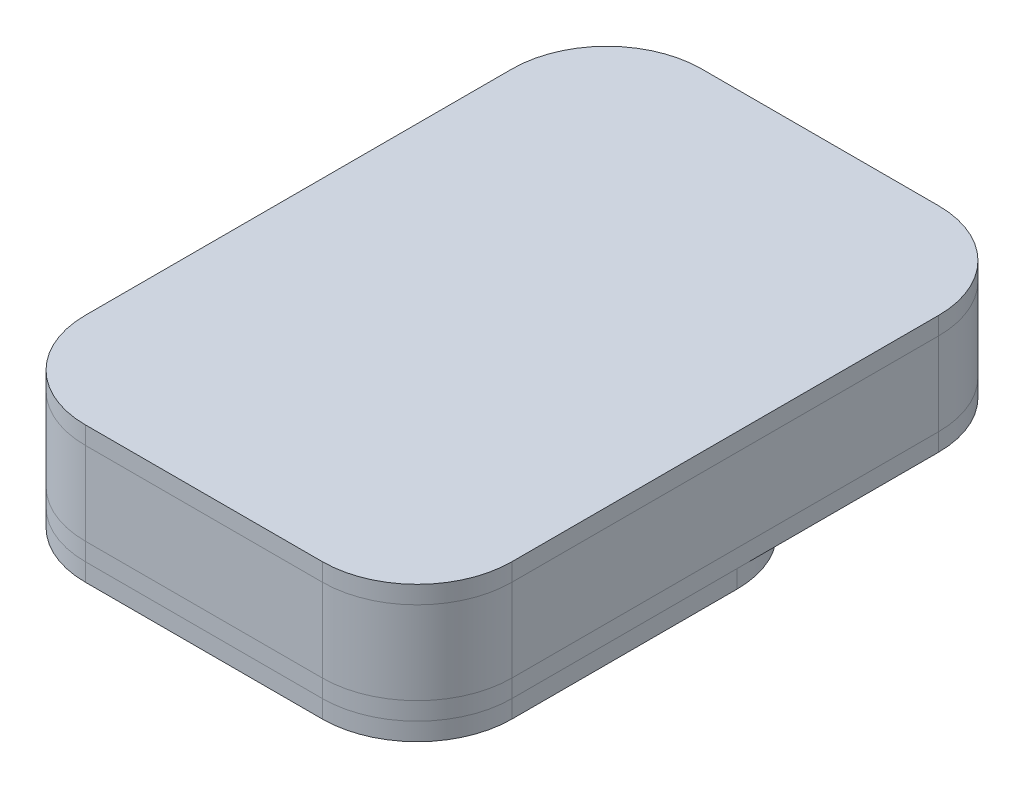
from build123d import *

# Parameters (mm, degrees)
SKETCH1_W           = 160
SKETCH1_H           = 240
BOSS_EXTRUDE1_DEPTH = 35
FILLET1_R           = 30
SHELL2_T            = 10
BOSS_EXTRUDE3_DEPTH = 7.5
BOSS_EXTRUDE4_DEPTH = 7.5
SKETCH6_W           = 180
SKETCH6_H           = 175
BOSS_EXTRUDE5_DEPTH = 7.5
FILLET2_R           = 40
SKETCH9_W           = 40
SKETCH9_H           = 60
CUT_EXTRUDE1_DEPTH  = 15
SKETCH10_W          = 40
SKETCH10_H          = 60
BOSS_EXTRUDE6_DEPTH = 7.5
SKETCH11_W          = 14.3
SKETCH11_H          = 26.3
CUT_EXTRUDE2_DEPTH  = 7.5
SKETCH12_R          = 10
CUT_EXTRUDE4_DEPTH  = 7.5


# Read off the part's stored shape, not the designer's step: Split2
with BuildPart() as part:
    # Sketch1 → Boss-Extrude1 (new body)
    with BuildSketch(Plane(origin=(0, 0, 0), x_dir=(1, 0, 0), z_dir=(0, 1, 0))):
        Rectangle(SKETCH1_W, SKETCH1_H)
    extrude(amount=BOSS_EXTRUDE1_DEPTH)

    # Fillet1
    fillet1_edges = [part.edges().sort_by_distance(p)[0] for p in [
        (-80, 17.5, 120),
        (-80, 17.5, -120),
        (80, 17.5, -120),
        (80, 17.5, 120),
    ]]
    fillet(fillet1_edges, radius=FILLET1_R)

    # Shell2
    shell2_openings = [part.faces().sort_by_distance(p)[0] for p in [
        (0, 0, 0),
        (0, 35, 0),
    ]]
    offset(amount=SHELL2_T, openings=shell2_openings, kind=Kind.INTERSECTION)


with BuildPart() as body_2:
    # Sketch2 → Boss-Extrude3 (new body)
    with BuildSketch(Plane.XZ):
        with BuildLine():
            Line((90, -90), (90, 90))
            ThreePointArc((90, 90), (78.284271247, 118.284271247), (50, 130))
            Line((50, 130), (-50, 130))
            ThreePointArc((-50, 130), (-78.284271247, 118.284271247), (-90, 90))
            Line((-90, 90), (-90, -90))
            ThreePointArc((-90, -90), (-78.284271247, -118.284271247), (-50, -130))
            Line((-50, -130), (50, -130))
            ThreePointArc((50, -130), (78.284271247, -118.284271247), (90, -90))
        make_face()
    extrude(amount=BOSS_EXTRUDE3_DEPTH)


with BuildPart() as body_3:
    # Sketch3 → Boss-Extrude4 (new body)
    with BuildSketch(Plane(origin=(0, 35, 0), x_dir=(1, 0, 0), z_dir=(0, 1, 0))):
        with BuildLine():
            Line((-50, -130), (50, -130))
            ThreePointArc((50, -130), (78.284271247, -118.284271247), (90, -90))
            Line((90, -90), (90, 90))
            ThreePointArc((90, 90), (78.284271247, 118.284271247), (50, 130))
            Line((50, 130), (-50, 130))
            ThreePointArc((-50, 130), (-78.284271247, 118.284271247), (-90, 90))
            Line((-90, 90), (-90, -90))
            ThreePointArc((-90, -90), (-78.284271247, -118.284271247), (-50, -130))
        make_face()
    extrude(amount=BOSS_EXTRUDE4_DEPTH)


with BuildPart() as body_4:
    # Sketch6 → Boss-Extrude5 (new body)
    with BuildSketch(Plane.XZ.offset(7.5)):
        with Locations((0, 42.5)):
            Rectangle(SKETCH6_W, SKETCH6_H)
    extrude(amount=BOSS_EXTRUDE5_DEPTH)

    # Fillet2
    fillet2_edges = [body_4.edges().sort_by_distance(p)[0] for p in [
        (-90, -11.25, 130),
        (90, -11.25, 130),
        (90, -11.25, -45),
        (-90, -11.25, -45),
    ]]
    fillet(fillet2_edges, radius=FILLET2_R)


with BuildPart() as cut_extrude1_tool:
    # Sketch9 → Cut-Extrude1 (new body)
    with BuildSketch(Plane.XZ.offset(15)):
        with Locations((0, 42.5)):
            Rectangle(SKETCH9_W, SKETCH9_H)
    extrude(amount=-CUT_EXTRUDE1_DEPTH)


with BuildPart() as body_2_1:
    add(body_2.part)

    # Cut-Extrude1: cut by cut_extrude1_tool
    add(cut_extrude1_tool.part, mode=Mode.SUBTRACT)



with BuildPart() as body_4_1:
    add(body_4.part)

    # Cut-Extrude1: cut by cut_extrude1_tool
    add(cut_extrude1_tool.part, mode=Mode.SUBTRACT)


with BuildPart() as body_2_2:
    add(body_2_1.part)

    add(body_4_1.part)  # Boss-Extrude6 merges body 4
    # Sketch10 → Boss-Extrude6 (add)
    with BuildSketch(Plane(origin=(0, -7.5, 0), x_dir=(1, 0, 0), z_dir=(0, 1, 0))):
        with Locations((0, -42.5)):
            Rectangle(SKETCH10_W, SKETCH10_H)
    extrude(amount=-BOSS_EXTRUDE6_DEPTH)

    # Sketch11 → Cut-Extrude2 (cut)
    with BuildSketch(Plane.XZ.offset(7.5)):
        with Locations((-25, -90)):
            Rectangle(SKETCH11_W, SKETCH11_H)
    extrude(amount=-CUT_EXTRUDE2_DEPTH, mode=Mode.SUBTRACT)

    # Sketch12 → Cut-Extrude4 (cut)
    with BuildSketch(Plane.XZ.offset(7.5)):
        with Locations(Location((12.5, -90, 0), (0, 0, 270))):
            Circle(SKETCH12_R)
        with Locations(Location((37.5, -90, 0), (0, 0, 270))):
            Circle(SKETCH12_R)
    extrude(amount=-CUT_EXTRUDE4_DEPTH, mode=Mode.SUBTRACT)


with BuildPart() as body_4_2:
    # Split2: the piece on the far side of the plane
    add(body_2_2.part)
    split(bisect_by=Plane(origin=(0, -7.5, 0), x_dir=(1, 0, 0), z_dir=(0, 1, 0)), keep=Keep.BOTTOM)


with BuildPart() as body_2_3:
    add(body_2_2.part)

    # Split2
    split(bisect_by=Plane(origin=(0, -7.5, 0), x_dir=(1, 0, 0), z_dir=(0, 1, 0)), keep=Keep.TOP)


solid = Compound([part.part, body_3.part, body_4_2.part, body_2_3.part])
